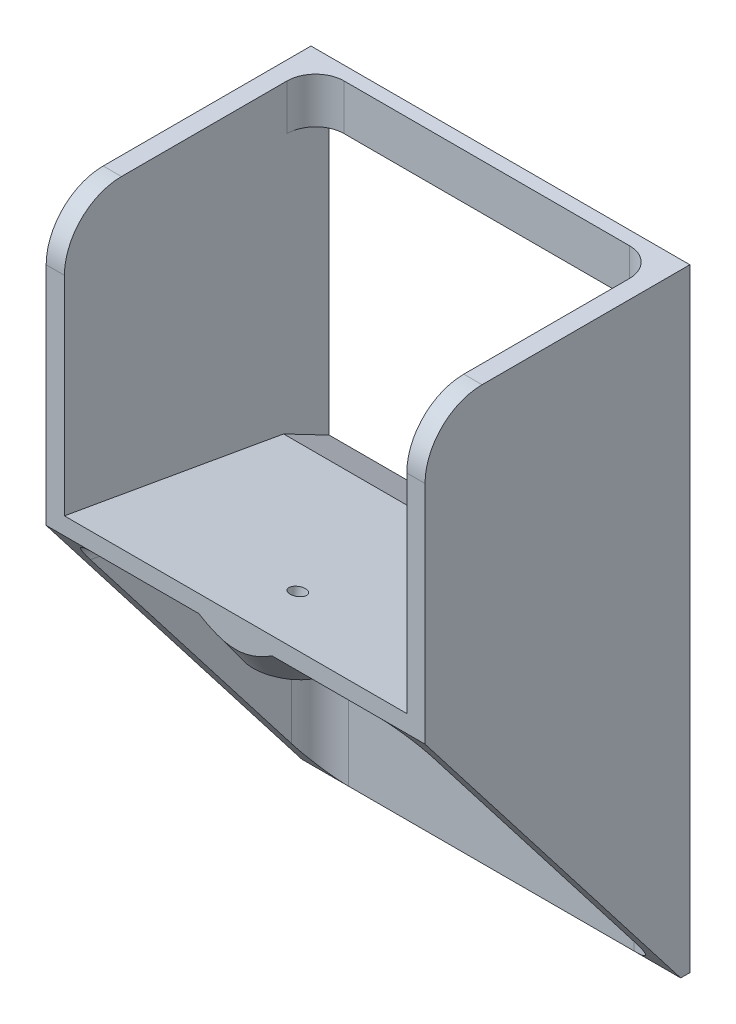
from build123d import *

# Parameters (mm, degrees)
BOSS_EXTRUDE1_DEPTH      = 30
BOSS_EXTRUDE1_DEPTH_BACK = 30
BOSS_EXTRUDE2_DEPTH      = 3.2
SKETCH3_R                = 1.35
CUT_EXTRUDE1_DEPTH       = 86.695011246
SKETCH4_R                = 6.35
SKETCH4_R_2              = 1.35
BOSS_EXTRUDE3_DEPTH      = 6
CHAMFER1_SIZE            = 6
FILLET1_R                = 5
SKETCH5_W                = 2.4
SKETCH5_H                = 8
BOSS_EXTRUDE4_DEPTH      = 60
FILLET2_R                = 5
FILLET3_R                = 10


with BuildPart() as part:
    # Sketch1 → Boss-Extrude1 (new, two sides: drawn at the far end of the back side and taken through both)
    with BuildSketch(Plane(origin=(0, 0, 0), x_dir=(0, 0, -1), z_dir=(1, 0, 0)).offset(-BOSS_EXTRUDE1_DEPTH_BACK)):
        Polygon((-8, 54.174772512), (-46.414198462, 60.948232143), (-46.414198462, 57.901952308), (-1.6, 50), (-1.6, 0), (0, 0), (0, 50), align=None)
    extrude(amount=BOSS_EXTRUDE1_DEPTH + BOSS_EXTRUDE1_DEPTH_BACK)

    # Sketch2 → Boss-Extrude2 (add)
    with BuildSketch(Plane(origin=(30, 0, 0), x_dir=(0, 0, -1), z_dir=(1, 0, 0))):
        Polygon((0, 0), (0, 107.45890736), (-46.414198462, 107.45890736), (-46.414198462, 57.901952308), (-1.6, 0), align=None)
    boss_extrude2 = extrude(amount=BOSS_EXTRUDE2_DEPTH)

    # Mirror1: Boss-Extrude2 across plane
    add(boss_extrude2.mirror(Plane(origin=(0, 0, 0), x_dir=(0, 0, 1), z_dir=(1, 0, 0))))

    # Sketch3 → Cut-Extrude1 (cut, through all)
    with BuildSketch(Plane(origin=(0, 51.173122664, -9.023202213), x_dir=(1, 0, 0), z_dir=(0, 0.984807753012208, -0.17364817766693144))):
        with Locations(Location((0, -45.21547888, 0), (0, 0, 270))):
            Circle(SKETCH3_R)
    extrude(amount=-CUT_EXTRUDE1_DEPTH, mode=Mode.SUBTRACT)

    # Sketch4 → Boss-Extrude3 (add)
    with BuildSketch(Plane(origin=(0, 48.218699405, -8.50225768), x_dir=(1, 0, 0), z_dir=(0, -0.9848077530122079, 0.1736481776669319))):
        with Locations(Location((0, 45.21547888, 0), (0, 0, 90))):
            Circle(SKETCH4_R)
        with Locations(Location((0, 45.21547888, 0), (0, 0, 90))):
            Circle(SKETCH4_R_2, mode=Mode.SUBTRACT)
    extrude(amount=BOSS_EXTRUDE3_DEPTH)

    # Chamfer1
    # the kernel refuses this chamfer: 6 mm, written as the material it adds along each edge
    with BuildSketch(Plane(origin=(0, 56.070284915, 36.026296477), x_dir=(0, 0.1736481776669323, 0.9848077530122077), z_dir=(1, 0, 0))) as chamfer1_piece_1_section:
        Polygon((6.35 + CHAMFER1_SIZE, 0), (6.35, CHAMFER1_SIZE), (6.35, 0), align=None)
    chamfer1_piece_1 = revolve(axis=Axis((0, 56.070284915, 36.026296477), (0, -0.9848077530122079, 0.1736481776669319)), mode=Mode.PRIVATE)
    chamfer1_piece_1 = split(chamfer1_piece_1, bisect_by=Plane(origin=(0, 51.643480969, 46.414198462), z_dir=(0, 0, -1)), keep=Keep.TOP, mode=Mode.PRIVATE)
    chamfer1_piece_1 = split(chamfer1_piece_1, bisect_by=Plane(origin=(0, 48.535444939, 27.846718406), z_dir=(0, 0.9848077530122079, -0.1736481776669319)), keep=Keep.TOP, mode=Mode.PRIVATE)
    add(chamfer1_piece_1)

    # Fillet1
    fillet1_edges = [part.edges().sort_by_distance(p)[0] for p in [
        (0, 50, 1.6),
        (-30, 53.950976154, 24.007099231),
        (30, 53.950976154, 24.007099231),
        (-30, 25, 1.6),
        (30, 25, 1.6),
    ]]
    fillet(fillet1_edges, radius=FILLET1_R)

    # Sketch5 → Boss-Extrude4 (add)
    with BuildSketch(Plane.ZY.offset(-30)):
        with Locations((1.2, 103.45890736)):
            Rectangle(SKETCH5_W, SKETCH5_H)
    extrude(amount=BOSS_EXTRUDE4_DEPTH)

    # Fillet2
    fillet2_edges = [part.edges().sort_by_distance(p)[0] for p in [
        (30, 103.45890736, 2.4),
        (-30, 103.45890736, 2.4),
    ]]
    fillet(fillet2_edges, radius=FILLET2_R)

    # Fillet3
    fillet3_edges = [part.edges().sort_by_distance(p)[0] for p in [
        (31.6, 107.45890736, 46.414198462),
        (-31.6, 107.45890736, 46.414198462),
    ]]
    fillet(fillet3_edges, radius=FILLET3_R)


solid = part.part
